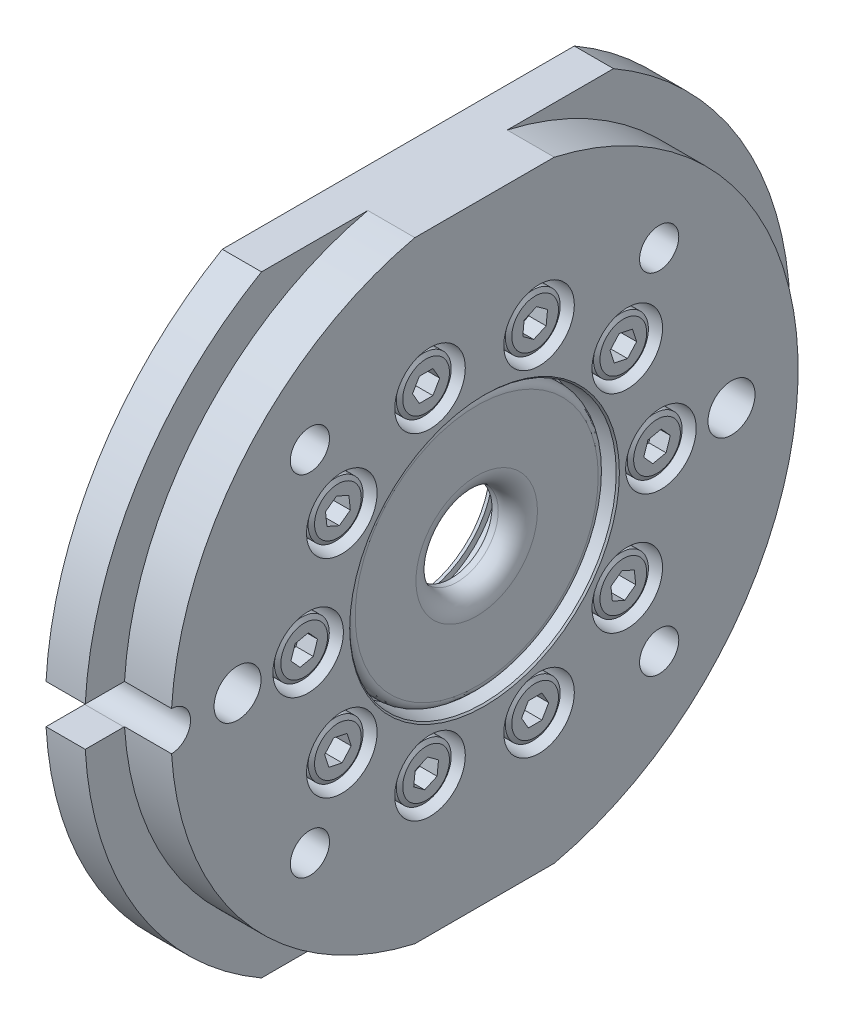
from build123d import *
from OCP.BRepFilletAPI import BRepFilletAPI_MakeChamfer

# Parameters (mm, degrees)
EXTRUDE_1_DEPTH              = 6
EXTRUDE_2_DEPTH              = 5
CUT_EXTRUDE_1_DEPTH          = 6
HOLE_WIZARD_M33_1_D          = 34
HOLE_WIZARD_M33_1_DEPTH      = 4.5
SKETCH_6_R                   = 16.5
EXTRUDE_3_DEPTH              = 3.5
SKETCH_7_R                   = 10.5
CUT_EXTRUDE_2_DEPTH          = 4.1
SKETCH_8_R                   = 9.7
CUT_EXTRUDE_3_DEPTH          = 0.2
CUT_EXTRUDE_4_REACH          = 682.064
SKETCH_9_R                   = 5.25
HOLE_WIZARD_M48_1_D          = 55
HOLE_WIZARD_M48_1_DEPTH      = 2
CUT_EXTRUDE_5_REACH          = 682.05
SKETCH_12_R                  = 9.7
HOLE_WIZARD_9_0_9_1_D        = 9
HOLE_WIZARD_9_0_9_1_DEPTH    = 5
SKETCH_15_R                  = 3.75
EXTRUDE_4_DEPTH              = 0.5
SKETCH_16_R                  = 3.5
EXTRUDE_5_DEPTH              = 4
CUT_EXTRUDE_6_DEPTH          = 2.2
HOLE_WIZARD_9_0_9_2_D        = 9
HOLE_WIZARD_9_0_9_2_DEPTH    = 5
SKETCH_20_R                  = 3.75
EXTRUDE_6_DEPTH              = 0.5
SKETCH_21_R                  = 3.5
EXTRUDE_7_DEPTH              = 4
CUT_EXTRUDE_7_DEPTH          = 2.2
HOLE_WIZARD_9_0_9_3_D        = 9
HOLE_WIZARD_9_0_9_3_DEPTH    = 5
SKETCH_25_R                  = 3.75
EXTRUDE_8_DEPTH              = 0.5
SKETCH_26_R                  = 3.5
EXTRUDE_9_DEPTH              = 4
CUT_EXTRUDE_8_DEPTH          = 2.2
HOLE_WIZARD_9_0_9_4_D        = 9
HOLE_WIZARD_9_0_9_4_DEPTH    = 5
SKETCH_30_R                  = 3.75
EXTRUDE_10_DEPTH             = 0.5
SKETCH_31_R                  = 3.5
EXTRUDE_11_DEPTH             = 4
CUT_EXTRUDE_9_DEPTH          = 2.2
HOLE_WIZARD_9_0_9_5_D        = 9
HOLE_WIZARD_9_0_9_5_DEPTH    = 5
SKETCH_35_R                  = 3.75
EXTRUDE_12_DEPTH             = 0.5
SKETCH_36_R                  = 3.5
EXTRUDE_13_DEPTH             = 4
CUT_EXTRUDE_10_DEPTH         = 2.2
HOLE_WIZARD_9_0_9_6_D        = 9
HOLE_WIZARD_9_0_9_6_DEPTH    = 5
SKETCH_40_R                  = 3.75
EXTRUDE_14_DEPTH             = 0.5
SKETCH_41_R                  = 3.5
EXTRUDE_15_DEPTH             = 4
CUT_EXTRUDE_11_DEPTH         = 2.2
HOLE_WIZARD_9_0_9_7_D        = 9
HOLE_WIZARD_9_0_9_7_DEPTH    = 5
SKETCH_45_R                  = 3.75
EXTRUDE_16_DEPTH             = 0.5
SKETCH_46_R                  = 3.5
EXTRUDE_17_DEPTH             = 4
CUT_EXTRUDE_12_DEPTH         = 2.2
HOLE_WIZARD_9_0_9_8_D        = 9
HOLE_WIZARD_9_0_9_8_DEPTH    = 5
SKETCH_50_R                  = 3.75
EXTRUDE_18_DEPTH             = 0.5
SKETCH_51_R                  = 3.5
EXTRUDE_19_DEPTH             = 4
CUT_EXTRUDE_13_DEPTH         = 2.2
HOLE_WIZARD_9_0_9_9_D        = 9
HOLE_WIZARD_9_0_9_9_DEPTH    = 5
SKETCH_55_R                  = 3.75
EXTRUDE_20_DEPTH             = 0.5
SKETCH_56_R                  = 3.5
EXTRUDE_21_DEPTH             = 4
CUT_EXTRUDE_14_DEPTH         = 2.2
HOLE_WIZARD_9_0_9_10_D       = 9
HOLE_WIZARD_9_0_9_10_DEPTH   = 5
SKETCH_60_R                  = 3.75
EXTRUDE_22_DEPTH             = 0.5
SKETCH_61_R                  = 3.5
EXTRUDE_23_DEPTH             = 4
CUT_EXTRUDE_15_DEPTH         = 2.2
HOLE_WIZARD_4_3_4_3_1_D      = 4.3
HOLE_WIZARD_4_3_4_3_1_DEPTH  = 4.5
HOLE_WIZARD_4_3_4_3_2_D      = 4.3
HOLE_WIZARD_4_3_4_3_2_DEPTH  = 4.5
HOLE_WIZARD_4_3_4_3_3_D      = 4.3
HOLE_WIZARD_4_3_4_3_3_DEPTH  = 4.5
HOLE_WIZARD_4_3_4_3_4_D      = 4.3
HOLE_WIZARD_4_3_4_3_4_DEPTH  = 4.5
HOLE_WIZARD_4_3_4_3_5_D      = 4.3
HOLE_WIZARD_4_3_4_3_5_DEPTH  = 4.5
HOLE_WIZARD_4_3_4_3_6_D      = 4.3
HOLE_WIZARD_4_3_4_3_6_DEPTH  = 4.5
HOLE_WIZARD_4_3_4_3_7_D      = 4.3
HOLE_WIZARD_4_3_4_3_7_DEPTH  = 4.5
HOLE_WIZARD_4_3_4_3_8_D      = 4.3
HOLE_WIZARD_4_3_4_3_8_DEPTH  = 4.5
HOLE_WIZARD_4_3_4_3_9_D      = 4.3
HOLE_WIZARD_4_3_4_3_9_DEPTH  = 4.5
HOLE_WIZARD_4_3_4_3_10_D     = 4.3
HOLE_WIZARD_4_3_4_3_10_DEPTH = 4.5
SKETCH_83_W                  = 4.5
SKETCH_83_H                  = 2
SKETCH_84_W                  = 4.5
SKETCH_84_H                  = 2
SKETCH_85_W                  = 4.5
SKETCH_85_H                  = 2
SKETCH_86_W                  = 4.5
SKETCH_86_H                  = 2
SKETCH_87_W                  = 4.5
SKETCH_87_H                  = 2
SKETCH_88_W                  = 4.5
SKETCH_88_H                  = 2
SKETCH_89_W                  = 4.5
SKETCH_89_H                  = 2
SKETCH_90_W                  = 4.5
SKETCH_90_H                  = 2
SKETCH_91_W                  = 4.5
SKETCH_91_H                  = 2
SKETCH_92_W                  = 4.5
SKETCH_92_H                  = 2
SKETCH_93_W                  = 4
SKETCH_93_H                  = 0.1
SKETCH_94_W                  = 4
SKETCH_94_H                  = 0.1
SKETCH_95_W                  = 4
SKETCH_95_H                  = 0.1
SKETCH_96_W                  = 4
SKETCH_96_H                  = 0.1
SKETCH_97_W                  = 4
SKETCH_97_H                  = 0.1
SKETCH_98_W                  = 4
SKETCH_98_H                  = 0.1
SKETCH_99_W                  = 4
SKETCH_99_H                  = 0.1
SKETCH_100_W                 = 4
SKETCH_100_H                 = 0.1
SKETCH_101_W                 = 4
SKETCH_101_H                 = 0.1
SKETCH_102_W                 = 4
SKETCH_102_H                 = 0.1
HOLE_WIZARD_5_0_5_1_D        = 5
HOLE_WIZARD_6_0_6_1_D        = 6
HOLE_WIZARD_6_0_6_1_DEPTH    = 6
CHAMFER_1_SIZE               = 0.519615242
CHAMFER_1_SIZE2              = 0.300000001
CHAMFER_2_SIZE               = 0.5
CHAMFER_3_SIZE               = 0.2
FILLET_1_R                   = 0.4
FILLET_2_R                   = 1
FILLET_3_R                   = 2.5


with BuildPart() as part:
    # ｽｹｯﾁ1 → ﾎﾞｽ - 押し出し1 (new body)
    with BuildSketch(Plane(origin=(503, 0, 0), x_dir=(0, 0, -1), z_dir=(1, 0, 0))):
        with BuildLine():
            Line((-8.888194417, 600.5), (22.449944321, 600.5))
            ThreePointArc((22.449944321, 600.5), (45, 639.5), (22.449944321, 678.5))
            Line((22.449944321, 678.5), (-8.888194417, 678.5))
            ThreePointArc((-8.888194417, 678.5), (-30.474423748, 665.409641009), (-39.921875, 641.998778999))
            ThreePointArc((-39.921875, 641.998778999), (-37.5, 639.5), (-39.921875, 637.001221001))
            ThreePointArc((-39.921875, 637.001221001), (-30.474423748, 613.590358991), (-8.888194417, 600.5))
        make_face()
    extrude(amount=-EXTRUDE_1_DEPTH)

    # ｽｹｯﾁ2 → ﾎﾞｽ - 押し出し2 (add)
    with BuildSketch(Plane.ZY.offset(-497)):
        with BuildLine():
            Line((-22.449944321, 678.5), (22.449944321, 678.5))
            ThreePointArc((22.449944321, 678.5), (38.315710001, 663.098863683), (44.930501889, 642))
            Line((44.930501889, 642), (40, 642))
            ThreePointArc((40, 642), (37.5, 639.5), (40, 637))
            Line((40, 637), (44.930501889, 637))
            ThreePointArc((44.930501889, 637), (38.315710001, 615.901136317), (22.449944321, 600.5))
            Line((22.449944321, 600.5), (-22.449944321, 600.5))
            ThreePointArc((-22.449944321, 600.5), (-45, 639.5), (-22.449944321, 678.5))
        make_face()
    extrude(amount=EXTRUDE_2_DEPTH)

    # ｽｹｯﾁ3 → ｶｯﾄ - 押し出し1 (cut)
    with BuildSketch(Plane(origin=(503, 0, 0), x_dir=(0, 0, -1), z_dir=(1, 0, 0))):
        with BuildLine():
            Line((8.888194417, 600.5), (22.449944321, 600.5))
            ThreePointArc((22.449944321, 600.5), (45, 639.5), (22.449944321, 678.5))
            Line((22.449944321, 678.5), (8.888194417, 678.5))
            ThreePointArc((8.888194417, 678.5), (40, 639.5), (8.888194417, 600.5))
        make_face()
    extrude(amount=-CUT_EXTRUDE_1_DEPTH, mode=Mode.SUBTRACT)

    # M33 ﾍﾘｺｲﾙ用ねじ下穴ﾄﾞﾘﾙ1
    with Locations(Plane(origin=(503, 0, 0), x_dir=(0, 0, -1), z_dir=(1, 0, 0))):
        with Locations((0, 639.5)):
            Hole(HOLE_WIZARD_M33_1_D / 2, depth=HOLE_WIZARD_M33_1_DEPTH)

    # ｽｹｯﾁ6 → ﾎﾞｽ - 押し出し3 (add)
    with BuildSketch(Plane(origin=(498.5, 0, 0), x_dir=(0, 0, -1), z_dir=(1, 0, 0))):
        with Locations((0, 639.5)):
            Circle(SKETCH_6_R)
    extrude(amount=EXTRUDE_3_DEPTH)

    # ｽｹｯﾁ7 → ｶｯﾄ - 押し出し2 (cut)
    with BuildSketch(Plane(origin=(494.4, 0, 0), x_dir=(0, -1, 0), z_dir=(-1, 0, 0))):
        with Locations((-639.5, 0)):
            Circle(SKETCH_7_R)
    extrude(amount=-CUT_EXTRUDE_2_DEPTH, mode=Mode.SUBTRACT)

    # ｽｹｯﾁ8 → ｶｯﾄ - 押し出し3 (cut)
    with BuildSketch(Plane.ZY.offset(-498.5)):
        with Locations((0, 639.5)):
            Circle(SKETCH_8_R)
    extrude(amount=-CUT_EXTRUDE_3_DEPTH, mode=Mode.SUBTRACT)

    # ｽｹｯﾁ9 → ｶｯﾄ - 押し出し4 (cut, up to next)
    with BuildSketch(Plane(origin=(502, 0, 0), x_dir=(0, 0, -1), z_dir=(1, 0, 0)), mode=Mode.PRIVATE) as cut_extrude_4_sk1:
        with Locations((0, 639.5)):
            Circle(SKETCH_9_R)
    cut_extrude_4_tool1 = extrude(cut_extrude_4_sk1.sketch, amount=-CUT_EXTRUDE_4_REACH, mode=Mode.PRIVATE) & part.part
    add(cut_extrude_4_tool1.solids().sort_by_distance((502, 639.5, 0))[0], mode=Mode.SUBTRACT)

    # M48 すきま穴1
    with Locations(Plane.ZY.offset(-492)):
        with Locations((0, 639.5)):
            Hole(HOLE_WIZARD_M48_1_D / 2, depth=HOLE_WIZARD_M48_1_DEPTH)

    # ｽｹｯﾁ12 → ｶｯﾄ - 押し出し5 (cut, up to next)
    with BuildSketch(Plane.ZY.offset(-494), mode=Mode.PRIVATE) as cut_extrude_5_sk1:
        with Locations((0, 639.5)):
            Circle(SKETCH_12_R)
    cut_extrude_5_tool1 = extrude(cut_extrude_5_sk1.sketch, amount=-CUT_EXTRUDE_5_REACH, mode=Mode.PRIVATE) & part.part
    add(cut_extrude_5_tool1.solids().sort_by_distance((494, 639.5, 0))[0], mode=Mode.SUBTRACT)

    # Ø9.0 (9) 直径の穴1
    with Locations(Plane(origin=(503, 0, 0), x_dir=(0, 0, -1), z_dir=(1, 0, 0))):
        with Locations((6.952882373, 618.101228383)):
            Hole(HOLE_WIZARD_9_0_9_1_D / 2, depth=HOLE_WIZARD_9_0_9_1_DEPTH)

    # ｽｹｯﾁ15 → ﾎﾞｽ - 押し出し4 (add)
    with BuildSketch(Plane(origin=(498, 0, 0), x_dir=(0, 0, -1), z_dir=(1, 0, 0))):
        with Locations((6.952882373, 618.101228383)):
            Circle(SKETCH_15_R)
    extrude(amount=EXTRUDE_4_DEPTH)

    # ｽｹｯﾁ16 → ﾎﾞｽ - 押し出し5 (add)
    with BuildSketch(Plane(origin=(498.5, 0, 0), x_dir=(0, 0, -1), z_dir=(1, 0, 0))):
        with Locations((6.952882373, 618.101228383)):
            Circle(SKETCH_16_R)
    extrude(amount=EXTRUDE_5_DEPTH)

    # ｽｹｯﾁ17 → ｶｯﾄ - 押し出し6 (cut)
    with BuildSketch(Plane(origin=(502.5, 0, 0), x_dir=(0, 0, -1), z_dir=(1, 0, 0))):
        Polygon((8.684933181, 618.101228383), (7.818907777, 619.601228383), (6.08685697, 619.601228383), (5.220831566, 618.101228383), (6.08685697, 616.601228383), (7.818907777, 616.601228383), align=None)
    extrude(amount=-CUT_EXTRUDE_6_DEPTH, mode=Mode.SUBTRACT)

    # Ø9.0 (9) 直径の穴2
    with Locations(Plane(origin=(503, 0, 0), x_dir=(0, 0, -1), z_dir=(1, 0, 0))):
        with Locations((18.202882373, 626.274831823)):
            Hole(HOLE_WIZARD_9_0_9_2_D / 2, depth=HOLE_WIZARD_9_0_9_2_DEPTH)

    # ｽｹｯﾁ20 → ﾎﾞｽ - 押し出し6 (add)
    with BuildSketch(Plane(origin=(498, 0, 0), x_dir=(0, 0, -1), z_dir=(1, 0, 0))):
        with Locations((18.202882373, 626.274831823)):
            Circle(SKETCH_20_R)
    extrude(amount=EXTRUDE_6_DEPTH)

    # ｽｹｯﾁ21 → ﾎﾞｽ - 押し出し7 (add)
    with BuildSketch(Plane(origin=(498.5, 0, 0), x_dir=(0, 0, -1), z_dir=(1, 0, 0))):
        with Locations((18.202882373, 626.274831823)):
            Circle(SKETCH_21_R)
    extrude(amount=EXTRUDE_7_DEPTH)

    # ｽｹｯﾁ22 → ｶｯﾄ - 押し出し7 (cut)
    with BuildSketch(Plane(origin=(502.5, 0, 0), x_dir=(0, 0, -1), z_dir=(1, 0, 0))):
        Polygon((19.604140912, 627.292905744), (18.021833764, 627.997394275), (16.620575226, 626.979320354), (16.801623835, 625.256757903), (18.383930983, 624.552269371), (19.785189521, 625.570343292), align=None)
    extrude(amount=-CUT_EXTRUDE_7_DEPTH, mode=Mode.SUBTRACT)

    # Ø9.0 (9) 直径の穴3
    with Locations(Plane(origin=(503, 0, 0), x_dir=(0, 0, -1), z_dir=(1, 0, 0))):
        with Locations((22.5, 639.5)):
            Hole(HOLE_WIZARD_9_0_9_3_D / 2, depth=HOLE_WIZARD_9_0_9_3_DEPTH)

    # ｽｹｯﾁ25 → ﾎﾞｽ - 押し出し8 (add)
    with BuildSketch(Plane(origin=(498, 0, 0), x_dir=(0, 0, -1), z_dir=(1, 0, 0))):
        with Locations((22.5, 639.5)):
            Circle(SKETCH_25_R)
    extrude(amount=EXTRUDE_8_DEPTH)

    # ｽｹｯﾁ26 → ﾎﾞｽ - 押し出し9 (add)
    with BuildSketch(Plane(origin=(498.5, 0, 0), x_dir=(0, 0, -1), z_dir=(1, 0, 0))):
        with Locations((22.5, 639.5)):
            Circle(SKETCH_26_R)
    extrude(amount=EXTRUDE_9_DEPTH)

    # ｽｹｯﾁ27 → ｶｯﾄ - 押し出し8 (cut)
    with BuildSketch(Plane(origin=(502.5, 0, 0), x_dir=(0, 0, -1), z_dir=(1, 0, 0))):
        Polygon((23.035233135, 641.147278207), (21.341031793, 640.787164595), (20.805798658, 639.139886388), (21.964766865, 637.852721793), (23.658968207, 638.212835405), (24.194201342, 639.860113612), align=None)
    extrude(amount=-CUT_EXTRUDE_8_DEPTH, mode=Mode.SUBTRACT)

    # Ø9.0 (9) 直径の穴4
    with Locations(Plane(origin=(503, 0, 0), x_dir=(0, 0, -1), z_dir=(1, 0, 0))):
        with Locations((18.202882373, 652.725168177)):
            Hole(HOLE_WIZARD_9_0_9_4_D / 2, depth=HOLE_WIZARD_9_0_9_4_DEPTH)

    # ｽｹｯﾁ30 → ﾎﾞｽ - 押し出し10 (add)
    with BuildSketch(Plane(origin=(498, 0, 0), x_dir=(0, 0, -1), z_dir=(1, 0, 0))):
        with Locations((18.202882373, 652.725168177)):
            Circle(SKETCH_30_R)
    extrude(amount=EXTRUDE_10_DEPTH)

    # ｽｹｯﾁ31 → ﾎﾞｽ - 押し出し11 (add)
    with BuildSketch(Plane(origin=(498.5, 0, 0), x_dir=(0, 0, -1), z_dir=(1, 0, 0))):
        with Locations((18.202882373, 652.725168177)):
            Circle(SKETCH_31_R)
    extrude(amount=EXTRUDE_11_DEPTH)

    # ｽｹｯﾁ32 → ｶｯﾄ - 押し出し9 (cut)
    with BuildSketch(Plane(origin=(502.5, 0, 0), x_dir=(0, 0, -1), z_dir=(1, 0, 0))):
        Polygon((17.667649239, 654.372446384), (16.508681032, 653.085281789), (17.043914166, 651.438003582), (18.738115508, 651.07788997), (19.897083715, 652.365054565), (19.361850581, 654.012332772), align=None)
    extrude(amount=-CUT_EXTRUDE_9_DEPTH, mode=Mode.SUBTRACT)

    # Ø9.0 (9) 直径の穴5
    with Locations(Plane(origin=(503, 0, 0), x_dir=(0, 0, -1), z_dir=(1, 0, 0))):
        with Locations((6.952882373, 660.898771617)):
            Hole(HOLE_WIZARD_9_0_9_5_D / 2, depth=HOLE_WIZARD_9_0_9_5_DEPTH)

    # ｽｹｯﾁ35 → ﾎﾞｽ - 押し出し12 (add)
    with BuildSketch(Plane(origin=(498, 0, 0), x_dir=(0, 0, -1), z_dir=(1, 0, 0))):
        with Locations((6.952882373, 660.898771617)):
            Circle(SKETCH_35_R)
    extrude(amount=EXTRUDE_12_DEPTH)

    # ｽｹｯﾁ36 → ﾎﾞｽ - 押し出し13 (add)
    with BuildSketch(Plane(origin=(498.5, 0, 0), x_dir=(0, 0, -1), z_dir=(1, 0, 0))):
        with Locations((6.952882373, 660.898771617)):
            Circle(SKETCH_36_R)
    extrude(amount=EXTRUDE_13_DEPTH)

    # ｽｹｯﾁ37 → ｶｯﾄ - 押し出し10 (cut)
    with BuildSketch(Plane(origin=(502.5, 0, 0), x_dir=(0, 0, -1), z_dir=(1, 0, 0))):
        Polygon((5.551623835, 661.916845538), (5.370575226, 660.194283086), (6.771833764, 659.176209165), (8.354140912, 659.880697696), (8.535189521, 661.603260148), (7.133930983, 662.621334069), align=None)
    extrude(amount=-CUT_EXTRUDE_10_DEPTH, mode=Mode.SUBTRACT)

    # Ø9.0 (9) 直径の穴6
    with Locations(Plane(origin=(503, 0, 0), x_dir=(0, 0, -1), z_dir=(1, 0, 0))):
        with Locations((-6.952882373, 660.898771617)):
            Hole(HOLE_WIZARD_9_0_9_6_D / 2, depth=HOLE_WIZARD_9_0_9_6_DEPTH)

    # ｽｹｯﾁ40 → ﾎﾞｽ - 押し出し14 (add)
    with BuildSketch(Plane(origin=(498, 0, 0), x_dir=(0, 0, -1), z_dir=(1, 0, 0))):
        with Locations((-6.952882373, 660.898771617)):
            Circle(SKETCH_40_R)
    extrude(amount=EXTRUDE_14_DEPTH)

    # ｽｹｯﾁ41 → ﾎﾞｽ - 押し出し15 (add)
    with BuildSketch(Plane(origin=(498.5, 0, 0), x_dir=(0, 0, -1), z_dir=(1, 0, 0))):
        with Locations((-6.952882373, 660.898771617)):
            Circle(SKETCH_41_R)
    extrude(amount=EXTRUDE_15_DEPTH)

    # ｽｹｯﾁ42 → ｶｯﾄ - 押し出し11 (cut)
    with BuildSketch(Plane(origin=(502.5, 0, 0), x_dir=(0, 0, -1), z_dir=(1, 0, 0))):
        Polygon((-8.684933181, 660.898771617), (-7.818907777, 659.398771617), (-6.08685697, 659.398771617), (-5.220831566, 660.898771617), (-6.08685697, 662.398771617), (-7.818907777, 662.398771617), align=None)
    extrude(amount=-CUT_EXTRUDE_11_DEPTH, mode=Mode.SUBTRACT)

    # Ø9.0 (9) 直径の穴7
    with Locations(Plane(origin=(503, 0, 0), x_dir=(0, 0, -1), z_dir=(1, 0, 0))):
        with Locations((-18.202882373, 652.725168177)):
            Hole(HOLE_WIZARD_9_0_9_7_D / 2, depth=HOLE_WIZARD_9_0_9_7_DEPTH)

    # ｽｹｯﾁ45 → ﾎﾞｽ - 押し出し16 (add)
    with BuildSketch(Plane(origin=(498, 0, 0), x_dir=(0, 0, -1), z_dir=(1, 0, 0))):
        with Locations((-18.202882373, 652.725168177)):
            Circle(SKETCH_45_R)
    extrude(amount=EXTRUDE_16_DEPTH)

    # ｽｹｯﾁ46 → ﾎﾞｽ - 押し出し17 (add)
    with BuildSketch(Plane(origin=(498.5, 0, 0), x_dir=(0, 0, -1), z_dir=(1, 0, 0))):
        with Locations((-18.202882373, 652.725168177)):
            Circle(SKETCH_46_R)
    extrude(amount=EXTRUDE_17_DEPTH)

    # ｽｹｯﾁ47 → ｶｯﾄ - 押し出し12 (cut)
    with BuildSketch(Plane(origin=(502.5, 0, 0), x_dir=(0, 0, -1), z_dir=(1, 0, 0))):
        Polygon((-19.604140912, 651.707094256), (-18.021833764, 651.002605725), (-16.620575226, 652.020679646), (-16.801623835, 653.743242097), (-18.383930983, 654.447730629), (-19.785189521, 653.429656708), align=None)
    extrude(amount=-CUT_EXTRUDE_12_DEPTH, mode=Mode.SUBTRACT)

    # Ø9.0 (9) 直径の穴8
    with Locations(Plane(origin=(503, 0, 0), x_dir=(0, 0, -1), z_dir=(1, 0, 0))):
        with Locations((-22.5, 639.5)):
            Hole(HOLE_WIZARD_9_0_9_8_D / 2, depth=HOLE_WIZARD_9_0_9_8_DEPTH)

    # ｽｹｯﾁ50 → ﾎﾞｽ - 押し出し18 (add)
    with BuildSketch(Plane(origin=(498, 0, 0), x_dir=(0, 0, -1), z_dir=(1, 0, 0))):
        with Locations((-22.5, 639.5)):
            Circle(SKETCH_50_R)
    extrude(amount=EXTRUDE_18_DEPTH)

    # ｽｹｯﾁ51 → ﾎﾞｽ - 押し出し19 (add)
    with BuildSketch(Plane(origin=(498.5, 0, 0), x_dir=(0, 0, -1), z_dir=(1, 0, 0))):
        with Locations((-22.5, 639.5)):
            Circle(SKETCH_51_R)
    extrude(amount=EXTRUDE_19_DEPTH)

    # ｽｹｯﾁ52 → ｶｯﾄ - 押し出し13 (cut)
    with BuildSketch(Plane(origin=(502.5, 0, 0), x_dir=(0, 0, -1), z_dir=(1, 0, 0))):
        Polygon((-23.035233135, 637.852721793), (-21.341031793, 638.212835405), (-20.805798658, 639.860113612), (-21.964766865, 641.147278207), (-23.658968207, 640.787164595), (-24.194201342, 639.139886388), align=None)
    extrude(amount=-CUT_EXTRUDE_13_DEPTH, mode=Mode.SUBTRACT)

    # Ø9.0 (9) 直径の穴9
    with Locations(Plane(origin=(503, 0, 0), x_dir=(0, 0, -1), z_dir=(1, 0, 0))):
        with Locations((-18.202882373, 626.274831823)):
            Hole(HOLE_WIZARD_9_0_9_9_D / 2, depth=HOLE_WIZARD_9_0_9_9_DEPTH)

    # ｽｹｯﾁ55 → ﾎﾞｽ - 押し出し20 (add)
    with BuildSketch(Plane(origin=(498, 0, 0), x_dir=(0, 0, -1), z_dir=(1, 0, 0))):
        with Locations((-18.202882373, 626.274831823)):
            Circle(SKETCH_55_R)
    extrude(amount=EXTRUDE_20_DEPTH)

    # ｽｹｯﾁ56 → ﾎﾞｽ - 押し出し21 (add)
    with BuildSketch(Plane(origin=(498.5, 0, 0), x_dir=(0, 0, -1), z_dir=(1, 0, 0))):
        with Locations((-18.202882373, 626.274831823)):
            Circle(SKETCH_56_R)
    extrude(amount=EXTRUDE_21_DEPTH)

    # ｽｹｯﾁ57 → ｶｯﾄ - 押し出し14 (cut)
    with BuildSketch(Plane(origin=(502.5, 0, 0), x_dir=(0, 0, -1), z_dir=(1, 0, 0))):
        Polygon((-17.667649239, 624.627553616), (-16.508681032, 625.914718211), (-17.043914166, 627.561996418), (-18.738115508, 627.92211003), (-19.897083715, 626.634945435), (-19.361850581, 624.987667228), align=None)
    extrude(amount=-CUT_EXTRUDE_14_DEPTH, mode=Mode.SUBTRACT)

    # Ø9.0 (9) 直径の穴10
    with Locations(Plane(origin=(503, 0, 0), x_dir=(0, 0, -1), z_dir=(1, 0, 0))):
        with Locations((-6.952882373, 618.101228383)):
            Hole(HOLE_WIZARD_9_0_9_10_D / 2, depth=HOLE_WIZARD_9_0_9_10_DEPTH)

    # ｽｹｯﾁ60 → ﾎﾞｽ - 押し出し22 (add)
    with BuildSketch(Plane(origin=(498, 0, 0), x_dir=(0, 0, -1), z_dir=(1, 0, 0))):
        with Locations((-6.952882373, 618.101228383)):
            Circle(SKETCH_60_R)
    extrude(amount=EXTRUDE_22_DEPTH)

    # ｽｹｯﾁ61 → ﾎﾞｽ - 押し出し23 (add)
    with BuildSketch(Plane(origin=(498.5, 0, 0), x_dir=(0, 0, -1), z_dir=(1, 0, 0))):
        with Locations((-6.952882373, 618.101228383)):
            Circle(SKETCH_61_R)
    extrude(amount=EXTRUDE_23_DEPTH)

    # ｽｹｯﾁ62 → ｶｯﾄ - 押し出し15 (cut)
    with BuildSketch(Plane(origin=(502.5, 0, 0), x_dir=(0, 0, -1), z_dir=(1, 0, 0))):
        Polygon((-5.551623835, 617.083154462), (-5.370575226, 618.805716914), (-6.771833764, 619.823790835), (-8.354140912, 619.119302304), (-8.535189521, 617.396739852), (-7.133930983, 616.378665931), align=None)
    extrude(amount=-CUT_EXTRUDE_15_DEPTH, mode=Mode.SUBTRACT)

    # Ø4.3 (4.3) 直径の穴1
    with Locations(Plane.ZY.offset(-494)):
        with Locations((-6.952882373, 618.101228383)):
            Hole(HOLE_WIZARD_4_3_4_3_1_D / 2, depth=HOLE_WIZARD_4_3_4_3_1_DEPTH)

    # Ø4.3 (4.3) 直径の穴2
    with Locations(Plane.ZY.offset(-494)):
        with Locations((-18.202882373, 626.274831823)):
            Hole(HOLE_WIZARD_4_3_4_3_2_D / 2, depth=HOLE_WIZARD_4_3_4_3_2_DEPTH)

    # Ø4.3 (4.3) 直径の穴3
    with Locations(Plane.ZY.offset(-494)):
        with Locations((-22.5, 639.5)):
            Hole(HOLE_WIZARD_4_3_4_3_3_D / 2, depth=HOLE_WIZARD_4_3_4_3_3_DEPTH)

    # Ø4.3 (4.3) 直径の穴4
    with Locations(Plane.ZY.offset(-494)):
        with Locations((-18.202882373, 652.725168177)):
            Hole(HOLE_WIZARD_4_3_4_3_4_D / 2, depth=HOLE_WIZARD_4_3_4_3_4_DEPTH)

    # Ø4.3 (4.3) 直径の穴5
    with Locations(Plane.ZY.offset(-494)):
        with Locations((-6.952882373, 660.898771617)):
            Hole(HOLE_WIZARD_4_3_4_3_5_D / 2, depth=HOLE_WIZARD_4_3_4_3_5_DEPTH)

    # Ø4.3 (4.3) 直径の穴6
    with Locations(Plane.ZY.offset(-494)):
        with Locations((6.952882373, 660.898771617)):
            Hole(HOLE_WIZARD_4_3_4_3_6_D / 2, depth=HOLE_WIZARD_4_3_4_3_6_DEPTH)

    # Ø4.3 (4.3) 直径の穴7
    with Locations(Plane.ZY.offset(-494)):
        with Locations((18.202882373, 652.725168177)):
            Hole(HOLE_WIZARD_4_3_4_3_7_D / 2, depth=HOLE_WIZARD_4_3_4_3_7_DEPTH)

    # Ø4.3 (4.3) 直径の穴8
    with Locations(Plane.ZY.offset(-494)):
        with Locations((22.5, 639.5)):
            Hole(HOLE_WIZARD_4_3_4_3_8_D / 2, depth=HOLE_WIZARD_4_3_4_3_8_DEPTH)

    # Ø4.3 (4.3) 直径の穴9
    with Locations(Plane.ZY.offset(-494)):
        with Locations((18.202882373, 626.274831823)):
            Hole(HOLE_WIZARD_4_3_4_3_9_D / 2, depth=HOLE_WIZARD_4_3_4_3_9_DEPTH)

    # Ø4.3 (4.3) 直径の穴10
    with Locations(Plane.ZY.offset(-494)):
        with Locations((6.952882373, 618.101228383)):
            Hole(HOLE_WIZARD_4_3_4_3_10_D / 2, depth=HOLE_WIZARD_4_3_4_3_10_DEPTH)

    # ｽｹｯﾁ83 → 回転1 (revolve)
    with BuildSketch(Plane(origin=(0, 0, 6.952882373), x_dir=(-1, 0, 0), z_dir=(0, 0, -1))):
        with Locations((-496.25, 619.101228383)):
            Rectangle(SKETCH_83_W, SKETCH_83_H)
    revolve(axis=Axis((498.5, 618.101228383, 6.952882373), (-1, 0, 0)))

    # ｽｹｯﾁ84 → 回転2 (revolve)
    with BuildSketch(Plane(origin=(0, 0, 18.202882373), x_dir=(-1, 0, 0), z_dir=(0, 0, -1))):
        with Locations((-496.25, 627.274831823)):
            Rectangle(SKETCH_84_W, SKETCH_84_H)
    revolve(axis=Axis((498.5, 626.274831823, 18.202882373), (-1, 0, 0)))

    # ｽｹｯﾁ85 → 回転3 (revolve)
    with BuildSketch(Plane(origin=(0, 0, 22.5), x_dir=(-1, 0, 0), z_dir=(0, 0, -1))):
        with Locations((-496.25, 640.5)):
            Rectangle(SKETCH_85_W, SKETCH_85_H)
    revolve(axis=Axis((498.5, 639.5, 22.5), (-1, 0, 0)))

    # ｽｹｯﾁ86 → 回転4 (revolve)
    with BuildSketch(Plane(origin=(0, 0, 18.202882373), x_dir=(-1, 0, 0), z_dir=(0, 0, -1))):
        with Locations((-496.25, 653.725168177)):
            Rectangle(SKETCH_86_W, SKETCH_86_H)
    revolve(axis=Axis((498.5, 652.725168177, 18.202882373), (-1, 0, 0)))

    # ｽｹｯﾁ87 → 回転5 (revolve)
    with BuildSketch(Plane(origin=(0, 0, 6.952882373), x_dir=(-1, 0, 0), z_dir=(0, 0, -1))):
        with Locations((-496.25, 661.898771617)):
            Rectangle(SKETCH_87_W, SKETCH_87_H)
    revolve(axis=Axis((498.5, 660.898771617, 6.952882373), (-1, 0, 0)))

    # ｽｹｯﾁ88 → 回転6 (revolve)
    with BuildSketch(Plane(origin=(0, 0, -6.952882373), x_dir=(-1, 0, 0), z_dir=(0, 0, -1))):
        with Locations((-496.25, 661.898771617)):
            Rectangle(SKETCH_88_W, SKETCH_88_H)
    revolve(axis=Axis((498.5, 660.898771617, -6.952882373), (-1, 0, 0)))

    # ｽｹｯﾁ89 → 回転7 (revolve)
    with BuildSketch(Plane(origin=(0, 0, -18.202882373), x_dir=(-1, 0, 0), z_dir=(0, 0, -1))):
        with Locations((-496.25, 653.725168177)):
            Rectangle(SKETCH_89_W, SKETCH_89_H)
    revolve(axis=Axis((498.5, 652.725168177, -18.202882373), (-1, 0, 0)))

    # ｽｹｯﾁ90 → 回転8 (revolve)
    with BuildSketch(Plane(origin=(0, 0, -22.5), x_dir=(-1, 0, 0), z_dir=(0, 0, -1))):
        with Locations((-496.25, 640.5)):
            Rectangle(SKETCH_90_W, SKETCH_90_H)
    revolve(axis=Axis((498.5, 639.5, -22.5), (-1, 0, 0)))

    # ｽｹｯﾁ91 → 回転9 (revolve)
    with BuildSketch(Plane(origin=(0, 0, -18.202882373), x_dir=(-1, 0, 0), z_dir=(0, 0, -1))):
        with Locations((-496.25, 627.274831823)):
            Rectangle(SKETCH_91_W, SKETCH_91_H)
    revolve(axis=Axis((498.5, 626.274831823, -18.202882373), (-1, 0, 0)))

    # ｽｹｯﾁ92 → 回転10 (revolve)
    with BuildSketch(Plane(origin=(0, 0, -6.952882373), x_dir=(-1, 0, 0), z_dir=(0, 0, -1))):
        with Locations((-496.25, 619.101228383)):
            Rectangle(SKETCH_92_W, SKETCH_92_H)
    revolve(axis=Axis((498.5, 618.101228383, -6.952882373), (-1, 0, 0)))

    # ｽｹｯﾁ93 → ｶｯﾄ - 回転1 (revolve, cut)
    with BuildSketch(Plane(origin=(0, 0, 6.952882373), x_dir=(-1, 0, 0), z_dir=(0, 0, -1))):
        with Locations((-496, 620.301228383)):
            Rectangle(SKETCH_93_W, SKETCH_93_H)
    revolve(axis=Axis((498, 618.101228383, 6.952882373), (-1, 0, 0)), mode=Mode.SUBTRACT)

    # ｽｹｯﾁ94 → ｶｯﾄ - 回転2 (revolve, cut)
    with BuildSketch(Plane(origin=(0, 0, 18.202882373), x_dir=(-1, 0, 0), z_dir=(0, 0, -1))):
        with Locations((-496, 628.474831823)):
            Rectangle(SKETCH_94_W, SKETCH_94_H)
    revolve(axis=Axis((498, 626.274831823, 18.202882373), (-1, 0, 0)), mode=Mode.SUBTRACT)

    # ｽｹｯﾁ95 → ｶｯﾄ - 回転3 (revolve, cut)
    with BuildSketch(Plane(origin=(0, 0, 22.5), x_dir=(-1, 0, 0), z_dir=(0, 0, -1))):
        with Locations((-496, 641.7)):
            Rectangle(SKETCH_95_W, SKETCH_95_H)
    revolve(axis=Axis((498, 639.5, 22.5), (-1, 0, 0)), mode=Mode.SUBTRACT)

    # ｽｹｯﾁ96 → ｶｯﾄ - 回転4 (revolve, cut)
    with BuildSketch(Plane(origin=(0, 0, 18.202882373), x_dir=(-1, 0, 0), z_dir=(0, 0, -1))):
        with Locations((-496, 654.925168177)):
            Rectangle(SKETCH_96_W, SKETCH_96_H)
    revolve(axis=Axis((498, 652.725168177, 18.202882373), (-1, 0, 0)), mode=Mode.SUBTRACT)

    # ｽｹｯﾁ97 → ｶｯﾄ - 回転5 (revolve, cut)
    with BuildSketch(Plane(origin=(0, 0, 6.952882373), x_dir=(-1, 0, 0), z_dir=(0, 0, -1))):
        with Locations((-496, 663.098771617)):
            Rectangle(SKETCH_97_W, SKETCH_97_H)
    revolve(axis=Axis((498, 660.898771617, 6.952882373), (-1, 0, 0)), mode=Mode.SUBTRACT)

    # ｽｹｯﾁ98 → ｶｯﾄ - 回転6 (revolve, cut)
    with BuildSketch(Plane(origin=(0, 0, -6.952882373), x_dir=(-1, 0, 0), z_dir=(0, 0, -1))):
        with Locations((-496, 663.098771617)):
            Rectangle(SKETCH_98_W, SKETCH_98_H)
    revolve(axis=Axis((498, 660.898771617, -6.952882373), (-1, 0, 0)), mode=Mode.SUBTRACT)

    # ｽｹｯﾁ99 → ｶｯﾄ - 回転7 (revolve, cut)
    with BuildSketch(Plane(origin=(0, 0, -18.202882373), x_dir=(-1, 0, 0), z_dir=(0, 0, -1))):
        with Locations((-496, 654.925168177)):
            Rectangle(SKETCH_99_W, SKETCH_99_H)
    revolve(axis=Axis((498, 652.725168177, -18.202882373), (-1, 0, 0)), mode=Mode.SUBTRACT)

    # ｽｹｯﾁ100 → ｶｯﾄ - 回転8 (revolve, cut)
    with BuildSketch(Plane(origin=(0, 0, -22.5), x_dir=(-1, 0, 0), z_dir=(0, 0, -1))):
        with Locations((-496, 641.7)):
            Rectangle(SKETCH_100_W, SKETCH_100_H)
    revolve(axis=Axis((498, 639.5, -22.5), (-1, 0, 0)), mode=Mode.SUBTRACT)

    # ｽｹｯﾁ101 → ｶｯﾄ - 回転9 (revolve, cut)
    with BuildSketch(Plane(origin=(0, 0, -18.202882373), x_dir=(-1, 0, 0), z_dir=(0, 0, -1))):
        with Locations((-496, 628.474831823)):
            Rectangle(SKETCH_101_W, SKETCH_101_H)
    revolve(axis=Axis((498, 626.274831823, -18.202882373), (-1, 0, 0)), mode=Mode.SUBTRACT)

    # ｽｹｯﾁ102 → ｶｯﾄ - 回転10 (revolve, cut)
    with BuildSketch(Plane(origin=(0, 0, -6.952882373), x_dir=(-1, 0, 0), z_dir=(0, 0, -1))):
        with Locations((-496, 620.301228383)):
            Rectangle(SKETCH_102_W, SKETCH_102_H)
    revolve(axis=Axis((498, 618.101228383, -6.952882373), (-1, 0, 0)), mode=Mode.SUBTRACT)

    # Ø5.0 (5) 直径の穴1 (through all)
    with Locations(Plane.ZY.offset(-492)):
        with Locations((22.273863607, 617.226136393), (-22.273863607, 617.226136393), (-22.273863607, 661.773863607), (22.273863607, 661.773863607)):
            Hole(HOLE_WIZARD_5_0_5_1_D / 2)

    # Ø6.0 (6) 直径の穴1
    with Locations(Plane(origin=(503, 0, 0), x_dir=(0, 0, -1), z_dir=(1, 0, 0))):
        with Locations((31.5, 639.5), (-31.5, 639.5)):
            Hole(HOLE_WIZARD_6_0_6_1_D / 2, depth=HOLE_WIZARD_6_0_6_1_DEPTH)

    # 面取り1: one chamfer whose edges measure the first distance from different faces: ONE call of the kernel's chamfer builder (chamfer() names one face for all edges)
    chamfer_1_edges_1 = [part.edges().sort_by_distance(p)[0] for p in [
        (502.5, 618.101228383, 10.452882373),
    ]]
    chamfer_1_side_1 = [part.faces().sort_by_distance(p)[0] for p in [
        (502.5, 618.101228383, 10.353887424),
    ]]
    chamfer_1_edges_2 = [part.edges().sort_by_distance(p)[0] for p in [
        (502.5, 639.5, -19),
    ]]
    chamfer_1_side_2 = [part.faces().sort_by_distance(p)[0] for p in [
        (502.5, 639.5, -19.098994949),
    ]]
    chamfer_1_edges_3 = [part.edges().sort_by_distance(p)[0] for p in [
        (502.5, 660.898771617, -3.452882373),
    ]]
    chamfer_1_side_3 = [part.faces().sort_by_distance(p)[0] for p in [
        (502.5, 660.898771617, -3.551877323),
    ]]
    chamfer_1_edges_4 = [part.edges().sort_by_distance(p)[0] for p in [
        (502.5, 626.274831823, 21.702882373),
    ]]
    chamfer_1_side_4 = [part.faces().sort_by_distance(p)[0] for p in [
        (502.5, 626.274831823, 21.603887424),
    ]]
    chamfer_1_edges_5 = [part.edges().sort_by_distance(p)[0] for p in [
        (502.5, 660.898771617, 10.452882373),
    ]]
    chamfer_1_side_5 = [part.faces().sort_by_distance(p)[0] for p in [
        (502.5, 660.898771617, 10.353887424),
    ]]
    chamfer_1_edges_6 = [part.edges().sort_by_distance(p)[0] for p in [
        (502.5, 626.274831823, -14.702882373),
    ]]
    chamfer_1_side_6 = [part.faces().sort_by_distance(p)[0] for p in [
        (502.5, 626.274831823, -14.801877323),
    ]]
    chamfer_1_edges_7 = [part.edges().sort_by_distance(p)[0] for p in [
        (502.5, 652.725168177, -14.702882373),
    ]]
    chamfer_1_side_7 = [part.faces().sort_by_distance(p)[0] for p in [
        (502.5, 652.725168177, -14.801877323),
    ]]
    chamfer_1_edges_8 = [part.edges().sort_by_distance(p)[0] for p in [
        (502.5, 618.101228383, -3.452882373),
    ]]
    chamfer_1_side_8 = [part.faces().sort_by_distance(p)[0] for p in [
        (502.5, 618.101228383, -3.551877323),
    ]]
    chamfer_1_edges_9 = [part.edges().sort_by_distance(p)[0] for p in [
        (502.5, 652.725168177, 21.702882373),
    ]]
    chamfer_1_side_9 = [part.faces().sort_by_distance(p)[0] for p in [
        (502.5, 652.725168177, 21.603887424),
    ]]
    chamfer_1_edges_10 = [part.edges().sort_by_distance(p)[0] for p in [
        (502.5, 639.5, 26),
    ]]
    chamfer_1_side_10 = [part.faces().sort_by_distance(p)[0] for p in [
        (502.5, 639.5, 25.901005051),
    ]]
    chamfer_1 = BRepFilletAPI_MakeChamfer(part.part.solid().wrapped)
    for e in chamfer_1_edges_1:
        chamfer_1.Add(CHAMFER_1_SIZE, CHAMFER_1_SIZE2, e.wrapped, chamfer_1_side_1[0].wrapped)  # the first distance lies on this face
    for e in chamfer_1_edges_2:
        chamfer_1.Add(CHAMFER_1_SIZE, CHAMFER_1_SIZE2, e.wrapped, chamfer_1_side_2[0].wrapped)  # the first distance lies on this face
    for e in chamfer_1_edges_3:
        chamfer_1.Add(CHAMFER_1_SIZE, CHAMFER_1_SIZE2, e.wrapped, chamfer_1_side_3[0].wrapped)  # the first distance lies on this face
    for e in chamfer_1_edges_4:
        chamfer_1.Add(CHAMFER_1_SIZE, CHAMFER_1_SIZE2, e.wrapped, chamfer_1_side_4[0].wrapped)  # the first distance lies on this face
    for e in chamfer_1_edges_5:
        chamfer_1.Add(CHAMFER_1_SIZE, CHAMFER_1_SIZE2, e.wrapped, chamfer_1_side_5[0].wrapped)  # the first distance lies on this face
    for e in chamfer_1_edges_6:
        chamfer_1.Add(CHAMFER_1_SIZE, CHAMFER_1_SIZE2, e.wrapped, chamfer_1_side_6[0].wrapped)  # the first distance lies on this face
    for e in chamfer_1_edges_7:
        chamfer_1.Add(CHAMFER_1_SIZE, CHAMFER_1_SIZE2, e.wrapped, chamfer_1_side_7[0].wrapped)  # the first distance lies on this face
    for e in chamfer_1_edges_8:
        chamfer_1.Add(CHAMFER_1_SIZE, CHAMFER_1_SIZE2, e.wrapped, chamfer_1_side_8[0].wrapped)  # the first distance lies on this face
    for e in chamfer_1_edges_9:
        chamfer_1.Add(CHAMFER_1_SIZE, CHAMFER_1_SIZE2, e.wrapped, chamfer_1_side_9[0].wrapped)  # the first distance lies on this face
    for e in chamfer_1_edges_10:
        chamfer_1.Add(CHAMFER_1_SIZE, CHAMFER_1_SIZE2, e.wrapped, chamfer_1_side_10[0].wrapped)  # the first distance lies on this face
    add(Compound.cast(chamfer_1.Shape()), mode=Mode.REPLACE)

    # 面取り2
    chamfer_2_edges = [part.edges().sort_by_distance(p)[0] for p in [
        (492, 639.5, 27.5),
    ]]
    chamfer(chamfer_2_edges, length=CHAMFER_2_SIZE)

    # 面取り3
    chamfer_3_edges = [part.edges().sort_by_distance(p)[0] for p in [
        (503, 639.5, -17),
    ]]
    chamfer(chamfer_3_edges, length=CHAMFER_3_SIZE)

    # ﾌｨﾚｯﾄ1
    fillet_1_edges = [part.edges().sort_by_distance(p)[0] for p in [
        (494, 639.5, 27.5),
    ]]
    fillet(fillet_1_edges, radius=FILLET_1_R)

    # ﾌｨﾚｯﾄ2
    fillet_2_edges = [part.edges().sort_by_distance(p)[0] for p in [
        (502, 639.5, 16.5),
    ]]
    fillet(fillet_2_edges, radius=FILLET_2_R)

    # ﾌｨﾚｯﾄ3
    fillet_3_edges = [part.edges().sort_by_distance(p)[0] for p in [
        (502, 639.5, 5.25),
    ]]
    fillet(fillet_3_edges, radius=FILLET_3_R)


solid = part.part
